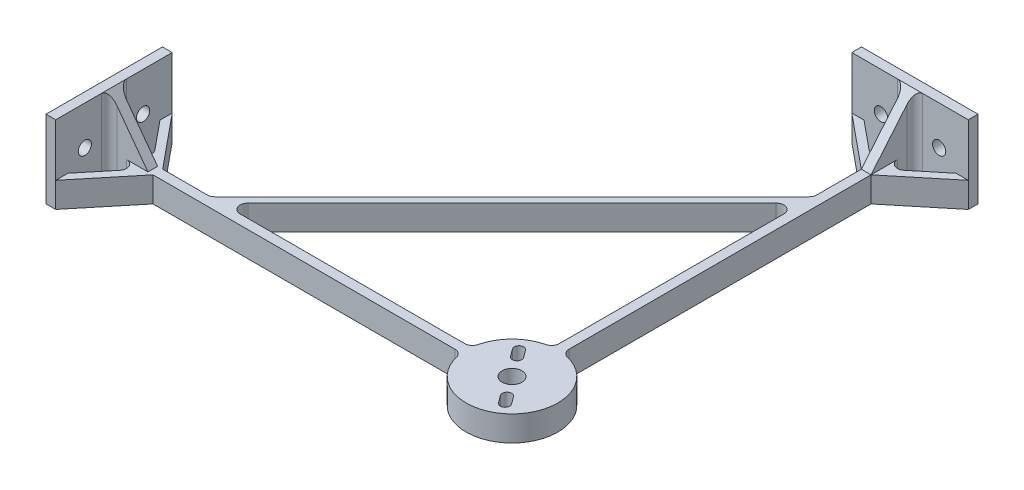
from build123d import *

# Parameters (mm, degrees)
SKETCH1_R                       = 15
BOSS_EXTRUDE2_DEPTH             = 8.255
BOSS_EXTRUDE3_DEPTH             = 8.255
SKETCH5_R                       = 3.249999977
CUT_EXTRUDE3_DEPTH              = 63.5
SKETCH7_W                       = 3.175
SKETCH7_H                       = 25.4
BOSS_EXTRUDE5_DEPTH             = 19.05
SKETCH12_R                      = 2.159
CUT_EXTRUDE6_DEPTH              = 199.993500208
CIRPATTERN2_COUNT               = 2
CIRPATTERN2_ANGLE               = 90
CIRPATTERN3_COUNT               = 2
CIRPATTERN3_ANGLE               = 90
BOSS_EXTRUDE6_DEPTH             = 8.255
BOSS_EXTRUDE7_REACH             = 192.288
BOSS_EXTRUDE7_DIRECTION_2_REACH = 192.288
BOSS_EXTRUDE8_REACH             = 192.288
BOSS_EXTRUDE8_DIRECTION_2_REACH = 192.288
FILLET1_R                       = 2.54


with BuildPart() as part:
    # Sketch1 → Boss-Extrude2 (new body)
    with BuildSketch(Plane(origin=(0, 0, 0), x_dir=(1, 0, 0), z_dir=(0, 1, 0))):
        with Locations(Location((0, 0, 0), (0, 0, 270))):
            Circle(SKETCH1_R)
    extrude(amount=BOSS_EXTRUDE2_DEPTH)

    # Sketch1<6> → Boss-Extrude3 (add)
    with BuildSketch(Plane(origin=(0, 0, 0), x_dir=(1, 0, 0), z_dir=(0, 1, 0))):
        with BuildLine():
            Line((-1.5875, 130.175), (-1.5875, 14.915758236))
            ThreePointArc((-1.5875, 14.915758236), (0, 15), (1.5875, 14.915758236))
            Line((1.5875, 14.915758236), (1.5875, 130.175))
            Line((1.5875, 130.175), (-1.5875, 130.175))
        make_face()
        with BuildLine():
            ThreePointArc((-14.915758236, -1.5875), (-15, 0), (-14.915758236, 1.5875))
            Line((-14.915758236, 1.5875), (-130.175, 1.5875))
            Line((-130.175, 1.5875), (-130.175, -1.5875))
            Line((-130.175, -1.5875), (-14.915758236, -1.5875))
        make_face()
    extrude(amount=BOSS_EXTRUDE3_DEPTH)

    # Sketch5 → Cut-Extrude3 (cut)
    with BuildSketch(Plane(origin=(0, 8.255, 0), x_dir=(1, 0, 0), z_dir=(0, 1, 0))):
        with Locations(Location((0, 0, 0), (0, 0, 270))):
            Circle(SKETCH5_R)
        with BuildLine():
            Line((-5.908712478, 5.423058993), (-7.721732332, 7.873214705))
            ThreePointArc((-7.721732332, 7.873214705), (-7.403164404, 10.004802487), (-5.271576621, 9.686234559))
            Line((-5.271576621, 9.686234559), (-3.458556767, 7.236078848))
            ThreePointArc((-3.458556767, 7.236078848), (-3.777124696, 5.104491065), (-5.908712478, 5.423058993))
        make_face()
        with BuildLine():
            Line((3.458556767, -7.236078848), (5.271576621, -9.686234559))
            ThreePointArc((5.271576621, -9.686234559), (7.403164404, -10.004802487), (7.721732332, -7.873214705))
            Line((7.721732332, -7.873214705), (5.908712478, -5.423058993))
            ThreePointArc((5.908712478, -5.423058993), (3.777124696, -5.104491065), (3.458556767, -7.236078848))
        make_face()
    extrude(amount=-CUT_EXTRUDE3_DEPTH, mode=Mode.SUBTRACT)

    # Sketch7 → Boss-Extrude5 (add, symmetric)
    with BuildSketch(Plane(origin=(0, 0, 0), x_dir=(0, 0, -1), z_dir=(1, 0, 0))):
        with Locations((131.7625, 12.7)):
            Rectangle(SKETCH7_W, SKETCH7_H)
    boss_extrude5 = extrude(amount=BOSS_EXTRUDE5_DEPTH, both=True)

    # Sketch12 → Cut-Extrude6 (cut, through all)
    with BuildSketch(Plane(origin=(0, 0, -133.35), x_dir=(-1, 0, 0), z_dir=(0, 0, -1))):
        with Locations((9.525, 12.7)):
            Circle(SKETCH12_R)
        with Locations(Location((-9.525, 12.7, 0), (0, 0, 180))):
            Circle(SKETCH12_R)
    cut_extrude6 = extrude(amount=-CUT_EXTRUDE6_DEPTH, mode=Mode.SUBTRACT)

    # CirPattern2: Boss-Extrude5 ×2 about axis
    cirpattern2_axis = Axis((0, 0, 0), (0, 1, 0))
    for i in range(1, CIRPATTERN2_COUNT):
        add(boss_extrude5.rotate(cirpattern2_axis, i * CIRPATTERN2_ANGLE / (CIRPATTERN2_COUNT - 1)))

    # CirPattern3: Cut-Extrude6 ×2 about axis
    cirpattern3_axis = Axis((0, 0, 0), (0, 1, 0))
    for i in range(1, CIRPATTERN3_COUNT):
        add(cut_extrude6.rotate(cirpattern3_axis, i * CIRPATTERN3_ANGLE / (CIRPATTERN3_COUNT - 1)), mode=Mode.SUBTRACT)

    # Sketch13 → Boss-Extrude6 (add)
    with BuildSketch(Plane.XZ):
        Polygon((-96.628948776, -1.5875), (-1.5875, -96.628948776), (-1.5875, -100.221051224), (-100.221051224, -1.5875), align=None)
        Polygon((-19.05, -130.175), (-1.5875, -115.831500599), (-1.5875, -119.118499401), (-15.048241783, -130.175), align=None)
        Polygon((19.05, -130.175), (1.5875, -115.831500599), (1.5875, -119.118499401), (15.048241783, -130.175), align=None)
        Polygon((-119.118499401, 1.5875), (-130.175, 15.048241783), (-130.175, 19.05), (-115.831500599, 1.5875), align=None)
        Polygon((-119.118499401, -1.5875), (-130.175, -15.048241783), (-130.175, -19.05), (-115.831500599, -1.5875), align=None)
    extrude(amount=-BOSS_EXTRUDE6_DEPTH)

    # Boss-Extrude7: up to this face of the body (flat: up to its plane)
    boss_extrude7_end = Plane(part.part.faces().sort_by_distance((-124.646749701, 4.1275, 1.5875))[0])
    # Sketch14 → Boss-Extrude7 (add, up to the picked face)
    with BuildSketch(Plane.XY, mode=Mode.PRIVATE) as boss_extrude7_sk1:
        Polygon((-130.175, 25.4), (-117.475, 8.255), (-130.175, 8.255), align=None)
    boss_extrude7_tool1 = split(extrude(boss_extrude7_sk1.sketch, amount=BOSS_EXTRUDE7_REACH, mode=Mode.PRIVATE), bisect_by=boss_extrude7_end, keep=Keep.BOTH, mode=Mode.PRIVATE)
    add(boss_extrude7_tool1.solids().sort_by(Axis((-125.941667, 13.97, 0), (0, 0, 1)))[0])

    # Boss-Extrude7 direction 2: up to this face of the body (flat: up to its plane)
    boss_extrude7_direction_2_end = Plane(part.part.faces().sort_by_distance((-124.646749701, 4.1275, -1.5875))[0])
    # Sketch14 → Boss-Extrude7 direction 2 (add, up to the picked face)
    with BuildSketch(Plane.XY, mode=Mode.PRIVATE) as boss_extrude7_direction_2_sk1:
        Polygon((-130.175, 25.4), (-117.475, 8.255), (-130.175, 8.255), align=None)
    boss_extrude7_direction_2_tool1 = split(extrude(boss_extrude7_direction_2_sk1.sketch, amount=-BOSS_EXTRUDE7_DIRECTION_2_REACH, mode=Mode.PRIVATE), bisect_by=boss_extrude7_direction_2_end, keep=Keep.BOTH, mode=Mode.PRIVATE)
    add(boss_extrude7_direction_2_tool1.solids().sort_by(Axis((-125.941667, 13.97, 0), (0, 0, -1)))[0])

    # Boss-Extrude8: up to this face of the body (flat: up to its plane)
    boss_extrude8_end = Plane(part.part.faces().sort_by_distance((1.5875, 4.1275, -65.373629417))[0])
    # Sketch15 → Boss-Extrude8 (add, up to the picked face)
    with BuildSketch(Plane(origin=(0, 0, 0), x_dir=(0, 0, -1), z_dir=(1, 0, 0)), mode=Mode.PRIVATE) as boss_extrude8_sk1:
        Polygon((130.175, 25.4), (115.831500599, 8.255), (130.175, 8.255), align=None)
    boss_extrude8_tool1 = split(extrude(boss_extrude8_sk1.sketch, amount=BOSS_EXTRUDE8_REACH, mode=Mode.PRIVATE), bisect_by=boss_extrude8_end, keep=Keep.BOTH, mode=Mode.PRIVATE)
    add(boss_extrude8_tool1.solids().sort_by(Axis((0, 13.97, -125.393834), (1, 0, 0)))[0])

    # Boss-Extrude8 direction 2: up to this face of the body (flat: up to its plane)
    boss_extrude8_direction_2_end = Plane(part.part.faces().sort_by_distance((-1.5875, 4.1275, -108.026275912))[0])
    # Sketch15 → Boss-Extrude8 direction 2 (add, up to the picked face)
    with BuildSketch(Plane(origin=(0, 0, 0), x_dir=(0, 0, -1), z_dir=(1, 0, 0)), mode=Mode.PRIVATE) as boss_extrude8_direction_2_sk1:
        Polygon((130.175, 25.4), (115.831500599, 8.255), (130.175, 8.255), align=None)
    boss_extrude8_direction_2_tool1 = split(extrude(boss_extrude8_direction_2_sk1.sketch, amount=-BOSS_EXTRUDE8_DIRECTION_2_REACH, mode=Mode.PRIVATE), bisect_by=boss_extrude8_direction_2_end, keep=Keep.BOTH, mode=Mode.PRIVATE)
    add(boss_extrude8_direction_2_tool1.solids().sort_by(Axis((0, 13.97, -125.393834), (-1, 0, 0)))[0])

    # Fillet1
    # the kernel refuses this fillet: 2.54 mm, written as the material it adds along each edge
    with BuildSketch(Plane(origin=(-1.5875, 0, -100.221051224), x_dir=(0, 0, -1), z_dir=(0, 1, 0)), Plane(origin=(-100.221051224, 0, -1.5875), x_dir=(0.7071067811865548, 0, -0.70710678118654), z_dir=(0, 1, 0))) as fillet1_piece_1:
        with BuildLine():
            CenterArc((FILLET1_R * 0.414213562373, FILLET1_R), FILLET1_R, 225, 45)
            Line((-FILLET1_R * 0.292893218813, FILLET1_R * 0.292893218813), (0, 0))
            Line((0, 0), (FILLET1_R * 0.414213562373, 0))
        make_face()
    extrude(amount=8.255)
    with BuildSketch(Plane(origin=(-1.5875, 0, -96.628948776), x_dir=(-0.7071067811865486, 0, 0.7071067811865464), z_dir=(0, 1, 0))) as fillet1_piece_2:
        with BuildLine():
            CenterArc((FILLET1_R * 2.41421356237, FILLET1_R), FILLET1_R, 135, 135)
            Line((FILLET1_R * 1.70710678119, FILLET1_R * 1.70710678119), (0, 0))
            Line((0, 0), (FILLET1_R * 2.41421356237, 0))
        make_face()
    extrude(amount=8.255)
    with BuildSketch(Plane(origin=(-96.628948776, 0, -1.5875), x_dir=(0.7071067811865482, 0, -0.7071067811865468), z_dir=(0, 1, 0))) as fillet1_piece_3:
        with BuildLine():
            CenterArc((FILLET1_R * 2.41421356237, -FILLET1_R), FILLET1_R, 90, 135)
            Line((FILLET1_R * 1.70710678119, -FILLET1_R * 1.70710678119), (0, 0))
            Line((0, 0), (FILLET1_R * 2.41421356237, 0))
        make_face()
    extrude(amount=8.255)
    with BuildSketch(Plane(origin=(-1.5875, 0, -119.118499401), x_dir=(-0.7727413829078122, 0, -0.6347210057511268), z_dir=(0, 1, 0)), Plane(origin=(-119.118499401, 0, 1.5875), x_dir=(-0.6347210057511247, 0, 0.772741382907814), z_dir=(0, 1, 0))) as fillet1_piece_4:
        with BuildLine():
            CenterArc((FILLET1_R * 2.11548267235, -FILLET1_R), FILLET1_R, 90, 129.399295056)
            Line((FILLET1_R * 1.34274128944, -FILLET1_R * 1.63472100575), (0, 0))
            Line((0, 0), (FILLET1_R * 2.11548267235, 0))
        make_face()
    extrude(amount=8.255)
    with BuildSketch(Plane(origin=(1.5875, 0, -119.118499401), x_dir=(0.7727413829078027, 0, -0.6347210057511384), z_dir=(0, 1, 0)), Plane(origin=(-119.118499401, 0, -1.5875), x_dir=(-0.6347210057511417, 0, -0.7727413829077999), z_dir=(0, 1, 0))) as fillet1_piece_5:
        with BuildLine():
            CenterArc((FILLET1_R * 2.11548267235, FILLET1_R), FILLET1_R, 140.600704944, 129.399295056)
            Line((FILLET1_R * 1.34274128944, FILLET1_R * 1.63472100575), (0, 0))
            Line((0, 0), (FILLET1_R * 2.11548267235, 0))
        make_face()
    extrude(amount=8.255)
    with BuildSketch(Plane(origin=(-1.5875, 0, -14.915758236), x_dir=(0, 0, -1), z_dir=(0, 1, 0)), Plane(origin=(-14.915758236, 0, 1.5875), x_dir=(-1, 0, 0), z_dir=(0, 1, 0))) as fillet1_piece_6:
        with BuildLine():
            CenterArc((2.131685671, 2.54), FILLET1_R, 193.610443403, 76.389556597)
            ThreePointArc((-0.336986366, 1.942289054), (-0.136551619, 0.976686375), (0, 0))
            Line((0, 0), (2.131685671, 0))
        make_face()
    extrude(amount=8.255)
    with BuildSketch(Plane(origin=(1.5875, 0, -14.915758236), x_dir=(0.9852804411442203, 0, 0.1709457583523227), z_dir=(0, 1, 0)), Plane(origin=(-14.915758236, 0, -1.5875), x_dir=(0.1709457583523069, 0, -0.985280441144223), z_dir=(0, 1, 0))) as fillet1_piece_7:
        with BuildLine():
            CenterArc((2.138209697, 2.534510424), FILLET1_R, 189.842811987, 76.389556597)
            Line((-0.364402624, 2.100308198), (0, 0))
            ThreePointArc((0, 0), (0.985652903, 0.032418754), (1.971305805, 0))
        make_face()
    extrude(amount=8.255)
    with BuildSketch(Plane(origin=(1.5875, 25.4, -130.175), x_dir=(0, 0, 1), z_dir=(0, -1, 0))) as fillet1_piece_8_section:
        with BuildLine():
            CenterArc((FILLET1_R, -FILLET1_R), FILLET1_R, 90, 90)
            Line((0, -FILLET1_R), (0, 0))
            Line((0, 0), (FILLET1_R, 0))
        make_face()
    fillet1_piece_8 = extrude(amount=25.4, mode=Mode.PRIVATE)
    fillet1_piece_8 = split(fillet1_piece_8, bisect_by=Plane(origin=(2.171046613, 17.455238274, -123.528415861), z_dir=(0, -0.6416616654193366, -0.7669878141999933)), keep=Keep.TOP, mode=Mode.PRIVATE)
    add(fillet1_piece_8)
    with BuildSketch(Plane(origin=(-1.5875, 25.4, -130.175), x_dir=(-1, 0, 0), z_dir=(0, -1, 0))) as fillet1_piece_9_section:
        with BuildLine():
            CenterArc((FILLET1_R, -FILLET1_R), FILLET1_R, 90, 90)
            Line((0, -FILLET1_R), (0, 0))
            Line((0, 0), (FILLET1_R, 0))
        make_face()
    fillet1_piece_9 = extrude(amount=25.4, mode=Mode.PRIVATE)
    fillet1_piece_9 = split(fillet1_piece_9, bisect_by=Plane(origin=(-2.171046613, 17.455238274, -123.528415861), z_dir=(0, -0.6416616654193366, -0.7669878141999933)), keep=Keep.TOP, mode=Mode.PRIVATE)
    add(fillet1_piece_9)
    with BuildSketch(Plane(origin=(-130.175, 25.4, -1.5875), x_dir=(1, 0, 0), z_dir=(0, -1, 0))) as fillet1_piece_10_section:
        with BuildLine():
            CenterArc((FILLET1_R, -FILLET1_R), FILLET1_R, 90, 90)
            Line((0, -FILLET1_R), (0, 0))
            Line((0, 0), (FILLET1_R, 0))
        make_face()
    fillet1_piece_10 = extrude(amount=25.4, mode=Mode.PRIVATE)
    fillet1_piece_10 = split(fillet1_piece_10, bisect_by=Plane(origin=(-123.721618639, 16.687935162, -2.172181801), z_dir=(-0.8035571933447456, -0.5952275506257377, 0)), keep=Keep.TOP, mode=Mode.PRIVATE)
    add(fillet1_piece_10)
    with BuildSketch(Plane(origin=(-130.175, 25.4, 1.5875), x_dir=(0, 0, 1), z_dir=(0, -1, 0))) as fillet1_piece_11_section:
        with BuildLine():
            CenterArc((FILLET1_R, -FILLET1_R), FILLET1_R, 90, 90)
            Line((0, -FILLET1_R), (0, 0))
            Line((0, 0), (FILLET1_R, 0))
        make_face()
    fillet1_piece_11 = extrude(amount=25.4, mode=Mode.PRIVATE)
    fillet1_piece_11 = split(fillet1_piece_11, bisect_by=Plane(origin=(-123.721618639, 16.687935162, 2.172181801), z_dir=(-0.8035571933447456, -0.5952275506257377, 0)), keep=Keep.TOP, mode=Mode.PRIVATE)
    add(fillet1_piece_11)


solid = part.part
